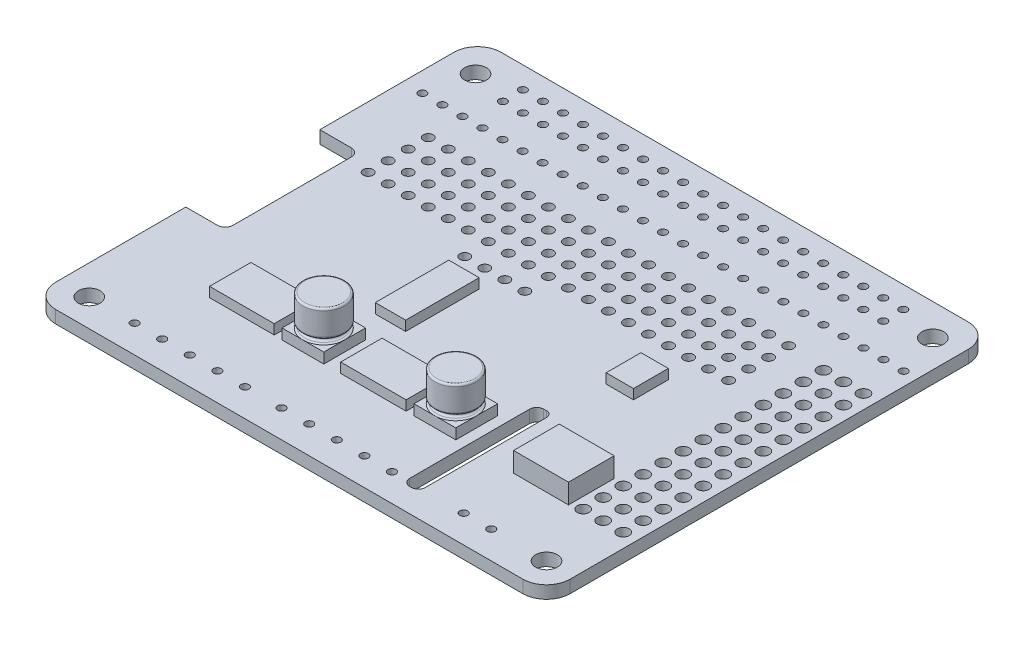
from build123d import *

# Parameters (mm, degrees)
SKETCH1_R               = 1.375
BOARD_DEPTH             = 1.6
SKETCH2_R               = 0.75
SKETCH2_R_2             = 0.5
SOME_HOLES_DEPTH        = 1.6
SKETCH2_4_R             = 0.5
SKETCH2_4_R_2           = 0.625
REMAINING_HOLES_DEPTH   = 1.6
SKETCH3_W               = 8.299273158
SKETCH3_H               = 5.249605127
SKETCH3_W_2             = 8.201345316
SKETCH3_W_3             = 3.465572732
SKETCH3_H_2             = 4.413450555
SKETCH3_W_4             = 3.853745634
SKETCH3_H_3             = 9.324821344
ICS_DEPTH               = 1.25
SKETCH3_5_W             = 6.963828066
SKETCH3_5_H             = 5.799690141
VOLTAGE_REGULATOR_DEPTH = 2.5
SKETCH4_W               = 5.3
SKETCH4_H               = 5.3
CAP_BASE_DEPTH          = 1.32
SKETCH5_R               = 2.65
CAP1_DEPTH              = 0.1
SKETCH8_R               = 2.15
CAP2_DEPTH              = 0.5
SKETCH9_R               = 2.65
SKETCH9_R_2             = 2.15
CAP3_DEPTH              = 3.38
CAP4_R                  = 0.24
CAP5_R                  = 0.25
CAP6_R                  = 0.25
CAP7_SIZE               = 0.1
CAP7_SIZE_2             = 0.25


# Some blends are built 0.0001 mm under size
with BuildPart() as part:
    # Sketch1 → Board (new body)
    with BuildSketch(Plane(origin=(0, 0, 0), x_dir=(1, 0, 0), z_dir=(0, 1, 0))):
        with BuildLine():
            Line((-12.770378968, 27.403386145), (-72.020378968, 27.403386145))
            ThreePointArc((-72.020378968, 27.403386145), (-74.141699312, 26.524706489), (-75.020378968, 24.403386145))
            Line((-75.020378968, 24.403386145), (-75.020378968, 7.403386145))
            Line((-75.020378968, 7.403386145), (-71.020378968, 7.403386145))
            ThreePointArc((-71.020378968, 7.403386145), (-70.313272187, 7.110492926), (-70.020378968, 6.403386145))
            Line((-70.020378968, 6.403386145), (-70.020378968, -8.596613855))
            ThreePointArc((-70.020378968, -8.596613855), (-70.313272187, -9.303720636), (-71.020378968, -9.596613855))
            Line((-71.020378968, -9.596613855), (-75.020378968, -9.596613855))
            Line((-75.020378968, -9.596613855), (-75.020378968, -26.096613855))
            ThreePointArc((-75.020378968, -26.096613855), (-74.141699312, -28.217934199), (-72.020378968, -29.096613855))
            Line((-72.020378968, -29.096613855), (-12.770378968, -29.096613855))
            ThreePointArc((-12.770378968, -29.096613855), (-10.649058625, -28.217934199), (-9.770378968, -26.096613855))
            Line((-9.770378968, -26.096613855), (-9.770378968, 24.403386145))
            ThreePointArc((-9.770378968, 24.403386145), (-10.649058625, 26.524706489), (-12.770378968, 27.403386145))
        make_face()
        with Locations(Location((-71.270378968, -25.596613855, 0), (0, 0, 270))):
            Circle(SKETCH1_R, mode=Mode.SUBTRACT)
        with BuildLine():
            Line((-30.120378968, -9.096613855), (-29.766856236, -9.096613855))
            ThreePointArc((-29.766856236, -9.096613855), (-29.239017098, -9.315251985), (-29.020378968, -9.843091122))
            Line((-29.020378968, -9.843091122), (-29.020378968, -25.196613855))
            ThreePointArc((-29.020378968, -25.196613855), (-29.283982865, -25.833009958), (-29.920378968, -26.096613855))
            Line((-29.920378968, -26.096613855), (-30.120378968, -26.096613855))
            ThreePointArc((-30.120378968, -26.096613855), (-30.756775072, -25.833009958), (-31.020378968, -25.196613855))
            Line((-31.020378968, -25.196613855), (-31.020378968, -9.996613855))
            ThreePointArc((-31.020378968, -9.996613855), (-30.756775072, -9.360217752), (-30.120378968, -9.096613855))
        make_face(mode=Mode.SUBTRACT)
        with Locations(Location((-13.270378968, -25.596613855, 0), (0, 0, 270))):
            Circle(SKETCH1_R, mode=Mode.SUBTRACT)
        with Locations(Location((-71.270378968, 23.403386145, 0), (0, 0, 270))):
            Circle(SKETCH1_R, mode=Mode.SUBTRACT)
        with Locations(Location((-13.270378968, 23.403386145, 0), (0, 0, 270))):
            Circle(SKETCH1_R, mode=Mode.SUBTRACT)
    extrude(amount=BOARD_DEPTH)

    # Sketch2 → Some Holes (cut)
    with BuildSketch(Plane(origin=(0, 1.6, 0), x_dir=(1, 0, 0), z_dir=(0, 1, 0))):
        with Locations(Location((-11.560378968, -15.036613855, 0), (0, 0, 270))):
            Circle(SKETCH2_R)
        with Locations(Location((-16.640378968, 7.823386145, 0), (0, 0, 270))):
            Circle(SKETCH2_R)
        with Locations(Location((-16.640378968, -17.576613855, 0), (0, 0, 270))):
            Circle(SKETCH2_R)
        with Locations(Location((-14.100378968, -17.576613855, 0), (0, 0, 270))):
            Circle(SKETCH2_R)
        with Locations(Location((-11.560378968, -17.576613855, 0), (0, 0, 270))):
            Circle(SKETCH2_R)
        with Locations(Location((-14.100378968, -15.036613855, 0), (0, 0, 270))):
            Circle(SKETCH2_R)
        with Locations(Location((-16.640378968, -15.036613855, 0), (0, 0, 270))):
            Circle(SKETCH2_R)
        with Locations(Location((-16.640378968, -12.496613855, 0), (0, 0, 270))):
            Circle(SKETCH2_R)
        with Locations(Location((-14.100378968, -12.496613855, 0), (0, 0, 270))):
            Circle(SKETCH2_R)
        with Locations(Location((-11.560378968, -12.496613855, 0), (0, 0, 270))):
            Circle(SKETCH2_R)
        with Locations(Location((-11.560378968, -9.956613855, 0), (0, 0, 270))):
            Circle(SKETCH2_R)
        with Locations(Location((-14.100378968, -9.956613855, 0), (0, 0, 270))):
            Circle(SKETCH2_R)
        with Locations(Location((-16.640378968, -9.956613855, 0), (0, 0, 270))):
            Circle(SKETCH2_R)
        with Locations(Location((-16.640378968, -7.416613855, 0), (0, 0, 270))):
            Circle(SKETCH2_R)
        with Locations(Location((-14.100378968, -7.416613855, 0), (0, 0, 270))):
            Circle(SKETCH2_R)
        with Locations(Location((-11.560378968, -7.416613855, 0), (0, 0, 270))):
            Circle(SKETCH2_R)
        with Locations(Location((-11.560378968, -4.876613855, 0), (0, 0, 270))):
            Circle(SKETCH2_R)
        with Locations(Location((-14.100378968, -4.876613855, 0), (0, 0, 270))):
            Circle(SKETCH2_R)
        with Locations(Location((-16.640378968, -4.876613855, 0), (0, 0, 270))):
            Circle(SKETCH2_R)
        with Locations(Location((-16.640378968, -2.336613855, 0), (0, 0, 270))):
            Circle(SKETCH2_R)
        with Locations(Location((-14.100378968, -2.336613855, 0), (0, 0, 270))):
            Circle(SKETCH2_R)
        with Locations(Location((-11.560378968, -2.336613855, 0), (0, 0, 270))):
            Circle(SKETCH2_R)
        with Locations(Location((-11.560378968, 0.203386145, 0), (0, 0, 270))):
            Circle(SKETCH2_R)
        with Locations(Location((-14.100378968, 0.203386145, 0), (0, 0, 270))):
            Circle(SKETCH2_R)
        with Locations(Location((-16.640378968, 0.203386145, 0), (0, 0, 270))):
            Circle(SKETCH2_R)
        with Locations(Location((-16.640378968, 2.743386145, 0), (0, 0, 270))):
            Circle(SKETCH2_R)
        with Locations(Location((-14.100378968, 2.743386145, 0), (0, 0, 270))):
            Circle(SKETCH2_R)
        with Locations(Location((-11.560378968, 2.743386145, 0), (0, 0, 270))):
            Circle(SKETCH2_R)
        with Locations(Location((-11.560378968, 5.283386145, 0), (0, 0, 270))):
            Circle(SKETCH2_R)
        with Locations(Location((-14.100378968, 5.283386145, 0), (0, 0, 270))):
            Circle(SKETCH2_R)
        with Locations(Location((-16.640378968, 5.283386145, 0), (0, 0, 270))):
            Circle(SKETCH2_R)
        with Locations(Location((-14.100378968, 7.823386145, 0), (0, 0, 270))):
            Circle(SKETCH2_R)
        with Locations(Location((-11.560378968, 7.823386145, 0), (0, 0, 270))):
            Circle(SKETCH2_R)
        with Locations(Location((-11.560378968, 10.363386145, 0), (0, 0, 270))):
            Circle(SKETCH2_R)
        with Locations(Location((-11.560378968, 12.903386145, 0), (0, 0, 270))):
            Circle(SKETCH2_R)
        with Locations(Location((-14.100378968, 10.363386145, 0), (0, 0, 270))):
            Circle(SKETCH2_R)
        with Locations(Location((-16.640378968, 10.363386145, 0), (0, 0, 270))):
            Circle(SKETCH2_R)
        with Locations(Location((-16.640378968, 12.903386145, 0), (0, 0, 270))):
            Circle(SKETCH2_R)
        with Locations(Location((-14.100378968, 12.903386145, 0), (0, 0, 270))):
            Circle(SKETCH2_R)
        with Locations(Location((-11.470378968, 17.903386145, 0), (0, 0, 270))):
            Circle(SKETCH2_R_2)
        with Locations(Location((-14.014128968, 17.903386145, 0), (0, 0, 270))):
            Circle(SKETCH2_R_2)
        with Locations(Location((-16.557878968, 17.903386145, 0), (0, 0, 270))):
            Circle(SKETCH2_R_2)
        with Locations(Location((-19.101628968, 17.903386145, 0), (0, 0, 270))):
            Circle(SKETCH2_R_2)
        with Locations(Location((-21.645378968, 17.903386145, 0), (0, 0, 270))):
            Circle(SKETCH2_R_2)
        with Locations(Location((-18.260378968, 22.113386145, 0), (0, 0, 270))):
            Circle(SKETCH2_R_2)
        with Locations(Location((-18.260378968, 24.653386145, 0), (0, 0, 270))):
            Circle(SKETCH2_R_2)
        with Locations(Location((-20.800378968, 22.113386145, 0), (0, 0, 270))):
            Circle(SKETCH2_R_2)
        with Locations(Location((-20.800378968, 24.653386145, 0), (0, 0, 270))):
            Circle(SKETCH2_R_2)
        with Locations(Location((-23.340378968, 22.113386145, 0), (0, 0, 270))):
            Circle(SKETCH2_R_2)
        with Locations(Location((-23.340378968, 24.653386145, 0), (0, 0, 270))):
            Circle(SKETCH2_R_2)
        with Locations(Location((-24.189128968, 17.903386145, 0), (0, 0, 270))):
            Circle(SKETCH2_R_2)
        with Locations(Location((-26.732878968, 17.903386145, 0), (0, 0, 270))):
            Circle(SKETCH2_R_2)
        with Locations(Location((-25.880378968, 22.113386145, 0), (0, 0, 270))):
            Circle(SKETCH2_R_2)
        with Locations(Location((-25.880378968, 24.653386145, 0), (0, 0, 270))):
            Circle(SKETCH2_R_2)
        with Locations(Location((-28.420378968, 24.653386145, 0), (0, 0, 270))):
            Circle(SKETCH2_R_2)
        with Locations(Location((-28.420378968, 22.113386145, 0), (0, 0, 270))):
            Circle(SKETCH2_R_2)
        with Locations(Location((-29.276628968, 17.903386145, 0), (0, 0, 270))):
            Circle(SKETCH2_R_2)
        with Locations(Location((-31.820378968, 17.903386145, 0), (0, 0, 270))):
            Circle(SKETCH2_R_2)
        with Locations(Location((-30.960378968, 22.113386145, 0), (0, 0, 270))):
            Circle(SKETCH2_R_2)
        with Locations(Location((-30.960378968, 24.653386145, 0), (0, 0, 270))):
            Circle(SKETCH2_R_2)
        with Locations(Location((-34.364128968, 17.903386145, 0), (0, 0, 270))):
            Circle(SKETCH2_R_2)
        with Locations(Location((-33.500378968, 22.113386145, 0), (0, 0, 270))):
            Circle(SKETCH2_R_2)
        with Locations(Location((-33.500378968, 24.653386145, 0), (0, 0, 270))):
            Circle(SKETCH2_R_2)
        with Locations(Location((-36.907878968, 17.903386145, 0), (0, 0, 270))):
            Circle(SKETCH2_R_2)
        with Locations(Location((-36.040378968, 22.113386145, 0), (0, 0, 270))):
            Circle(SKETCH2_R_2)
        with Locations(Location((-36.040378968, 24.653386145, 0), (0, 0, 270))):
            Circle(SKETCH2_R_2)
        with Locations(Location((-39.451628968, 17.903386145, 0), (0, 0, 270))):
            Circle(SKETCH2_R_2)
        with Locations(Location((-38.580378968, 22.113386145, 0), (0, 0, 270))):
            Circle(SKETCH2_R_2)
        with Locations(Location((-38.580378968, 24.653386145, 0), (0, 0, 270))):
            Circle(SKETCH2_R_2)
        with Locations(Location((-41.995378968, 17.903386145, 0), (0, 0, 270))):
            Circle(SKETCH2_R_2)
        with Locations(Location((-41.120378968, 22.113386145, 0), (0, 0, 270))):
            Circle(SKETCH2_R_2)
        with Locations(Location((-41.120378968, 24.653386145, 0), (0, 0, 270))):
            Circle(SKETCH2_R_2)
        with Locations(Location((-44.539128968, 17.903386145, 0), (0, 0, 270))):
            Circle(SKETCH2_R_2)
        with Locations(Location((-43.660378968, 22.113386145, 0), (0, 0, 270))):
            Circle(SKETCH2_R_2)
        with Locations(Location((-43.660378968, 24.653386145, 0), (0, 0, 270))):
            Circle(SKETCH2_R_2)
        with Locations(Location((-46.200378968, 24.653386145, 0), (0, 0, 270))):
            Circle(SKETCH2_R_2)
        with Locations(Location((-46.200378968, 22.113386145, 0), (0, 0, 270))):
            Circle(SKETCH2_R_2)
        with Locations(Location((-47.082878968, 17.903386145, 0), (0, 0, 270))):
            Circle(SKETCH2_R_2)
        with Locations(Location((-49.626628968, 17.903386145, 0), (0, 0, 270))):
            Circle(SKETCH2_R_2)
        with Locations(Location((-48.740378968, 22.113386145, 0), (0, 0, 270))):
            Circle(SKETCH2_R_2)
        with Locations(Location((-48.740378968, 24.653386145, 0), (0, 0, 270))):
            Circle(SKETCH2_R_2)
        with Locations(Location((-51.280378968, 24.653386145, 0), (0, 0, 270))):
            Circle(SKETCH2_R_2)
        with Locations(Location((-51.280378968, 22.113386145, 0), (0, 0, 270))):
            Circle(SKETCH2_R_2)
        with Locations(Location((-52.170378968, 17.903386145, 0), (0, 0, 270))):
            Circle(SKETCH2_R_2)
        with Locations(Location((-54.714128968, 17.903386145, 0), (0, 0, 270))):
            Circle(SKETCH2_R_2)
        with Locations(Location((-53.820378968, 22.113386145, 0), (0, 0, 270))):
            Circle(SKETCH2_R_2)
        with Locations(Location((-53.820378968, 24.653386145, 0), (0, 0, 270))):
            Circle(SKETCH2_R_2)
        with Locations(Location((-56.360378968, 24.653386145, 0), (0, 0, 270))):
            Circle(SKETCH2_R_2)
        with Locations(Location((-56.360378968, 22.113386145, 0), (0, 0, 270))):
            Circle(SKETCH2_R_2)
        with Locations(Location((-57.257878968, 17.903386145, 0), (0, 0, 270))):
            Circle(SKETCH2_R_2)
        with Locations(Location((-59.801628968, 17.903386145, 0), (0, 0, 270))):
            Circle(SKETCH2_R_2)
        with Locations(Location((-58.900378968, 22.113386145, 0), (0, 0, 270))):
            Circle(SKETCH2_R_2)
        with Locations(Location((-58.900378968, 24.653386145, 0), (0, 0, 270))):
            Circle(SKETCH2_R_2)
        with Locations(Location((-61.440378968, 24.653386145, 0), (0, 0, 270))):
            Circle(SKETCH2_R_2)
        with Locations(Location((-61.440378968, 22.113386145, 0), (0, 0, 270))):
            Circle(SKETCH2_R_2)
        with Locations(Location((-62.345378968, 17.903386145, 0), (0, 0, 270))):
            Circle(SKETCH2_R_2)
        with Locations(Location((-64.889128968, 17.903386145, 0), (0, 0, 270))):
            Circle(SKETCH2_R_2)
        with Locations(Location((-63.980378968, 22.113386145, 0), (0, 0, 270))):
            Circle(SKETCH2_R_2)
        with Locations(Location((-63.980378968, 24.653386145, 0), (0, 0, 270))):
            Circle(SKETCH2_R_2)
        with Locations(Location((-66.520378968, 24.653386145, 0), (0, 0, 270))):
            Circle(SKETCH2_R_2)
    extrude(amount=-SOME_HOLES_DEPTH, mode=Mode.SUBTRACT)

    # Sketch2<4> → Remaining Holes (cut)
    with BuildSketch(Plane(origin=(0, 1.6, 0), x_dir=(1, 0, 0), z_dir=(0, 1, 0))):
        with Locations(Location((-66.520378968, 22.113386145, 0), (0, 0, 270))):
            Circle(SKETCH2_4_R)
        with Locations(Location((-72.520378968, 17.903386145, 0), (0, 0, 270))):
            Circle(SKETCH2_4_R)
        with Locations(Location((-69.976628968, 17.903386145, 0), (0, 0, 270))):
            Circle(SKETCH2_4_R)
        with Locations(Location((-67.432878968, 17.903386145, 0), (0, 0, 270))):
            Circle(SKETCH2_4_R)
        with Locations(Location((-67.270378968, 13.403386145, 0), (0, 0, 270))):
            Circle(SKETCH2_4_R_2)
        with Locations(Location((-64.730378968, 13.403386145, 0), (0, 0, 270))):
            Circle(SKETCH2_4_R_2)
        with Locations(Location((-62.190378968, 13.403386145, 0), (0, 0, 270))):
            Circle(SKETCH2_4_R_2)
        with Locations(Location((-59.650378968, 13.403386145, 0), (0, 0, 270))):
            Circle(SKETCH2_4_R_2)
        with Locations(Location((-57.110378968, 13.403386145, 0), (0, 0, 270))):
            Circle(SKETCH2_4_R_2)
        with Locations(Location((-54.570378968, 13.403386145, 0), (0, 0, 270))):
            Circle(SKETCH2_4_R_2)
        with Locations(Location((-52.030378968, 13.403386145, 0), (0, 0, 270))):
            Circle(SKETCH2_4_R_2)
        with Locations(Location((-49.490378968, 13.403386145, 0), (0, 0, 270))):
            Circle(SKETCH2_4_R_2)
        with Locations(Location((-46.950378968, 13.403386145, 0), (0, 0, 270))):
            Circle(SKETCH2_4_R_2)
        with Locations(Location((-44.410378968, 13.403386145, 0), (0, 0, 270))):
            Circle(SKETCH2_4_R_2)
        with Locations(Location((-41.870378968, 13.403386145, 0), (0, 0, 270))):
            Circle(SKETCH2_4_R_2)
        with Locations(Location((-39.330378968, 13.403386145, 0), (0, 0, 270))):
            Circle(SKETCH2_4_R_2)
        with Locations(Location((-36.790378968, 13.403386145, 0), (0, 0, 270))):
            Circle(SKETCH2_4_R_2)
        with Locations(Location((-34.250378968, 13.403386145, 0), (0, 0, 270))):
            Circle(SKETCH2_4_R_2)
        with Locations(Location((-31.710378968, 13.403386145, 0), (0, 0, 270))):
            Circle(SKETCH2_4_R_2)
        with Locations(Location((-29.170378968, 13.403386145, 0), (0, 0, 270))):
            Circle(SKETCH2_4_R_2)
        with Locations(Location((-26.630378968, 13.403386145, 0), (0, 0, 270))):
            Circle(SKETCH2_4_R_2)
        with Locations(Location((-24.090378968, 13.403386145, 0), (0, 0, 270))):
            Circle(SKETCH2_4_R_2)
        with Locations(Location((-21.550378968, 13.403386145, 0), (0, 0, 270))):
            Circle(SKETCH2_4_R_2)
        with Locations(Location((-64.730378968, 10.863386145, 0), (0, 0, 270))):
            Circle(SKETCH2_4_R_2)
        with Locations(Location((-62.190378968, 10.863386145, 0), (0, 0, 270))):
            Circle(SKETCH2_4_R_2)
        with Locations(Location((-59.650378968, 10.863386145, 0), (0, 0, 270))):
            Circle(SKETCH2_4_R_2)
        with Locations(Location((-57.110378968, 10.863386145, 0), (0, 0, 270))):
            Circle(SKETCH2_4_R_2)
        with Locations(Location((-54.570378968, 10.863386145, 0), (0, 0, 270))):
            Circle(SKETCH2_4_R_2)
        with Locations(Location((-52.030378968, 10.863386145, 0), (0, 0, 270))):
            Circle(SKETCH2_4_R_2)
        with Locations(Location((-49.490378968, 10.863386145, 0), (0, 0, 270))):
            Circle(SKETCH2_4_R_2)
        with Locations(Location((-46.950378968, 10.863386145, 0), (0, 0, 270))):
            Circle(SKETCH2_4_R_2)
        with Locations(Location((-44.410378968, 10.863386145, 0), (0, 0, 270))):
            Circle(SKETCH2_4_R_2)
        with Locations(Location((-41.870378968, 10.863386145, 0), (0, 0, 270))):
            Circle(SKETCH2_4_R_2)
        with Locations(Location((-39.330378968, 10.863386145, 0), (0, 0, 270))):
            Circle(SKETCH2_4_R_2)
        with Locations(Location((-36.790378968, 10.863386145, 0), (0, 0, 270))):
            Circle(SKETCH2_4_R_2)
        with Locations(Location((-34.250378968, 10.863386145, 0), (0, 0, 270))):
            Circle(SKETCH2_4_R_2)
        with Locations(Location((-31.710378968, 10.863386145, 0), (0, 0, 270))):
            Circle(SKETCH2_4_R_2)
        with Locations(Location((-29.170378968, 10.863386145, 0), (0, 0, 270))):
            Circle(SKETCH2_4_R_2)
        with Locations(Location((-26.630378968, 10.863386145, 0), (0, 0, 270))):
            Circle(SKETCH2_4_R_2)
        with Locations(Location((-24.090378968, 10.863386145, 0), (0, 0, 270))):
            Circle(SKETCH2_4_R_2)
        with Locations(Location((-21.550378968, 10.863386145, 0), (0, 0, 270))):
            Circle(SKETCH2_4_R_2)
        with Locations(Location((-64.730378968, 8.323386145, 0), (0, 0, 270))):
            Circle(SKETCH2_4_R_2)
        with Locations(Location((-62.190378968, 8.323386145, 0), (0, 0, 270))):
            Circle(SKETCH2_4_R_2)
        with Locations(Location((-59.650378968, 8.323386145, 0), (0, 0, 270))):
            Circle(SKETCH2_4_R_2)
        with Locations(Location((-57.110378968, 8.323386145, 0), (0, 0, 270))):
            Circle(SKETCH2_4_R_2)
        with Locations(Location((-54.570378968, 8.323386145, 0), (0, 0, 270))):
            Circle(SKETCH2_4_R_2)
        with Locations(Location((-52.030378968, 8.323386145, 0), (0, 0, 270))):
            Circle(SKETCH2_4_R_2)
        with Locations(Location((-49.490378968, 8.323386145, 0), (0, 0, 270))):
            Circle(SKETCH2_4_R_2)
        with Locations(Location((-46.950378968, 8.323386145, 0), (0, 0, 270))):
            Circle(SKETCH2_4_R_2)
        with Locations(Location((-44.410378968, 8.323386145, 0), (0, 0, 270))):
            Circle(SKETCH2_4_R_2)
        with Locations(Location((-41.870378968, 8.323386145, 0), (0, 0, 270))):
            Circle(SKETCH2_4_R_2)
        with Locations(Location((-39.330378968, 8.323386145, 0), (0, 0, 270))):
            Circle(SKETCH2_4_R_2)
        with Locations(Location((-36.790378968, 8.323386145, 0), (0, 0, 270))):
            Circle(SKETCH2_4_R_2)
        with Locations(Location((-34.250378968, 8.323386145, 0), (0, 0, 270))):
            Circle(SKETCH2_4_R_2)
        with Locations(Location((-31.710378968, 8.323386145, 0), (0, 0, 270))):
            Circle(SKETCH2_4_R_2)
        with Locations(Location((-29.170378968, 8.323386145, 0), (0, 0, 270))):
            Circle(SKETCH2_4_R_2)
        with Locations(Location((-26.630378968, 8.323386145, 0), (0, 0, 270))):
            Circle(SKETCH2_4_R_2)
        with Locations(Location((-24.090378968, 8.323386145, 0), (0, 0, 270))):
            Circle(SKETCH2_4_R_2)
        with Locations(Location((-21.550378968, 8.323386145, 0), (0, 0, 270))):
            Circle(SKETCH2_4_R_2)
        with Locations(Location((-64.730378968, 5.783386145, 0), (0, 0, 270))):
            Circle(SKETCH2_4_R_2)
        with Locations(Location((-62.190378968, 5.783386145, 0), (0, 0, 270))):
            Circle(SKETCH2_4_R_2)
        with Locations(Location((-59.650378968, 5.783386145, 0), (0, 0, 270))):
            Circle(SKETCH2_4_R_2)
        with Locations(Location((-57.110378968, 5.783386145, 0), (0, 0, 270))):
            Circle(SKETCH2_4_R_2)
        with Locations(Location((-54.570378968, 5.783386145, 0), (0, 0, 270))):
            Circle(SKETCH2_4_R_2)
        with Locations(Location((-52.030378968, 5.783386145, 0), (0, 0, 270))):
            Circle(SKETCH2_4_R_2)
        with Locations(Location((-49.490378968, 5.783386145, 0), (0, 0, 270))):
            Circle(SKETCH2_4_R_2)
        with Locations(Location((-46.950378968, 5.783386145, 0), (0, 0, 270))):
            Circle(SKETCH2_4_R_2)
        with Locations(Location((-44.410378968, 5.783386145, 0), (0, 0, 270))):
            Circle(SKETCH2_4_R_2)
        with Locations(Location((-41.870378968, 5.783386145, 0), (0, 0, 270))):
            Circle(SKETCH2_4_R_2)
        with Locations(Location((-39.330378968, 5.783386145, 0), (0, 0, 270))):
            Circle(SKETCH2_4_R_2)
        with Locations(Location((-36.790378968, 5.783386145, 0), (0, 0, 270))):
            Circle(SKETCH2_4_R_2)
        with Locations(Location((-34.250378968, 5.783386145, 0), (0, 0, 270))):
            Circle(SKETCH2_4_R_2)
        with Locations(Location((-31.710378968, 5.783386145, 0), (0, 0, 270))):
            Circle(SKETCH2_4_R_2)
        with Locations(Location((-29.170378968, 5.783386145, 0), (0, 0, 270))):
            Circle(SKETCH2_4_R_2)
        with Locations(Location((-26.630378968, 5.783386145, 0), (0, 0, 270))):
            Circle(SKETCH2_4_R_2)
        with Locations(Location((-24.090378968, 5.783386145, 0), (0, 0, 270))):
            Circle(SKETCH2_4_R_2)
        with Locations(Location((-21.550378968, 5.783386145, 0), (0, 0, 270))):
            Circle(SKETCH2_4_R_2)
        with Locations(Location((-67.270378968, 10.863386145, 0), (0, 0, 270))):
            Circle(SKETCH2_4_R_2)
        with Locations(Location((-67.270378968, 8.323386145, 0), (0, 0, 270))):
            Circle(SKETCH2_4_R_2)
        with Locations(Location((-67.270378968, 5.783386145, 0), (0, 0, 270))):
            Circle(SKETCH2_4_R_2)
        with Locations(Location((-44.270378968, 2.653386145, 0), (0, 0, 270))):
            Circle(SKETCH2_4_R_2)
        with Locations(Location((-46.810378968, 2.653386145, 0), (0, 0, 270))):
            Circle(SKETCH2_4_R_2)
        with Locations(Location((-49.350378968, 2.653386145, 0), (0, 0, 270))):
            Circle(SKETCH2_4_R_2)
        with Locations(Location((-51.890378968, 2.653386145, 0), (0, 0, 270))):
            Circle(SKETCH2_4_R_2)
        with Locations(Location((-20.270378968, -25.596613855, 0), (0, 0, 270))):
            Circle(SKETCH2_4_R)
        with Locations(Location((-23.770378968, -25.596613855, 0), (0, 0, 270))):
            Circle(SKETCH2_4_R)
        with Locations(Location((-32.870378968, -25.596613855, 0), (0, 0, 270))):
            Circle(SKETCH2_4_R)
        with Locations(Location((-36.370378968, -25.596613855, 0), (0, 0, 270))):
            Circle(SKETCH2_4_R)
        with Locations(Location((-39.870378968, -25.596613855, 0), (0, 0, 270))):
            Circle(SKETCH2_4_R)
        with Locations(Location((-43.370378968, -25.596613855, 0), (0, 0, 270))):
            Circle(SKETCH2_4_R)
        with Locations(Location((-46.870378968, -25.596613855, 0), (0, 0, 270))):
            Circle(SKETCH2_4_R)
        with Locations(Location((-65.520378968, -25.596613855, 0), (0, 0, 270))):
            Circle(SKETCH2_4_R)
        with Locations(Location((-62.020378968, -25.596613855, 0), (0, 0, 270))):
            Circle(SKETCH2_4_R)
        with Locations(Location((-58.520378968, -25.596613855, 0), (0, 0, 270))):
            Circle(SKETCH2_4_R)
        with Locations(Location((-55.020378968, -25.596613855, 0), (0, 0, 270))):
            Circle(SKETCH2_4_R)
        with Locations(Location((-51.520378968, -25.596613855, 0), (0, 0, 270))):
            Circle(SKETCH2_4_R)
    extrude(amount=-REMAINING_HOLES_DEPTH, mode=Mode.SUBTRACT)

    # Sketch3 → ICs (add)
    with BuildSketch(Plane(origin=(0, 1.6, 0), x_dir=(1, 0, 0), z_dir=(0, 1, 0))):
        with Locations((-42.773872867, -15.424180304)):
            Rectangle(SKETCH3_W, SKETCH3_H)
        with Locations((-59.455950908, -15.424180304)):
            Rectangle(SKETCH3_W_2, SKETCH3_H)
        with Locations((-27.176884672, -0.18103568)):
            Rectangle(SKETCH3_W_3, SKETCH3_H_2)
        with Locations((-49.336031492, -4.662410672)):
            Rectangle(SKETCH3_W_4, SKETCH3_H_3)
    extrude(amount=ICS_DEPTH)

    # Sketch3<5> → Voltage Regulator (add)
    with BuildSketch(Plane(origin=(0, 1.6, 0), x_dir=(1, 0, 0), z_dir=(0, 1, 0))):
        with Locations((-21.512408584, -15.149137796)):
            Rectangle(SKETCH3_5_W, SKETCH3_5_H)
    extrude(amount=VOLTAGE_REGULATOR_DEPTH)

    # Sketch4 → Cap Base (add)
    with BuildSketch(Plane(origin=(0, 1.6, 0), x_dir=(1, 0, 0), z_dir=(0, 1, 0))):
        with Locations((-51.670378968, -15.446613855)):
            Rectangle(SKETCH4_W, SKETCH4_H)
        with Locations((-34.970378968, -15.404370659)):
            Rectangle(SKETCH4_W, SKETCH4_H)
    extrude(amount=CAP_BASE_DEPTH)

    # Sketch5 → Cap1 (add)
    with BuildSketch(Plane(origin=(0, 2.92, 0), x_dir=(1, 0, 0), z_dir=(0, 1, 0))):
        with Locations(Location((-51.670378968, -15.446613855, 0), (0, 0, 270))):
            Circle(SKETCH5_R)
        with Locations(Location((-34.970378968, -15.404370659, 0), (0, 0, 270))):
            Circle(SKETCH5_R)
    extrude(amount=CAP1_DEPTH)

    # Sketch8 → Cap2 (add)
    with BuildSketch(Plane(origin=(0, 3.02, 0), x_dir=(1, 0, 0), z_dir=(0, 1, 0))):
        with Locations(Location((-34.970378968, -15.404370659, 0), (0, 0, 270))):
            Circle(SKETCH8_R)
        with Locations(Location((-51.670378968, -15.446613855, 0), (0, 0, 270))):
            Circle(SKETCH8_R)
    extrude(amount=CAP2_DEPTH)

    # Sketch9 → Cap3 (add)
    # profile 1 of 4: a face of its own
    with BuildSketch(Plane(origin=(0, 3.52, 0), x_dir=(1, 0, 0), z_dir=(0, 1, 0))):
        with Locations(Location((-51.670378968, -15.446613855, 0), (0, 0, 270))):
            Circle(SKETCH9_R)
        with Locations(Location((-51.670378968, -15.446613855, 0), (0, 0, 270))):
            Circle(SKETCH9_R_2, mode=Mode.SUBTRACT)
    # profile 2 of 4: a face of its own
    with BuildSketch(Plane(origin=(0, 3.52, 0), x_dir=(1, 0, 0), z_dir=(0, 1, 0))):
        with Locations(Location((-51.670378968, -15.446613855, 0), (0, 0, 270))):
            Circle(SKETCH9_R_2)
    # profile 3 of 4: a face of its own
    with BuildSketch(Plane(origin=(0, 3.52, 0), x_dir=(1, 0, 0), z_dir=(0, 1, 0))):
        with Locations(Location((-34.970378968, -15.404370659, 0), (0, 0, 270))):
            Circle(SKETCH9_R)
        with Locations(Location((-34.970378968, -15.404370659, 0), (0, 0, 270))):
            Circle(SKETCH9_R_2, mode=Mode.SUBTRACT)
    # profile 4 of 4: a face of its own
    with BuildSketch(Plane(origin=(0, 3.52, 0), x_dir=(1, 0, 0), z_dir=(0, 1, 0))):
        with Locations(Location((-34.970378968, -15.404370659, 0), (0, 0, 270))):
            Circle(SKETCH9_R_2)
    extrude(amount=CAP3_DEPTH)

    # Cap4
    cap4_edges = [part.edges().sort_by_distance(p)[0] for p in [
        (-51.670378968, 6.9, 12.796613855),
        (-34.970378968, 6.9, 12.754370659),
    ]]
    fillet(cap4_edges, radius=CAP4_R)

    # Cap5
    cap5_edges = [part.edges().sort_by_distance(p)[0] for p in [
        (-34.970378968, 3.02, 13.254370659),
        (-34.970378968, 3.52, 13.254370659),
        (-51.670378968, 3.02, 13.296613855),
        (-51.670378968, 3.52, 13.296613855),
    ]]
    fillet(cap5_edges, radius=CAP5_R - 0.0001)  # a hair under: the kernel refuses the full size

    # Cap6
    cap6_edges = [part.edges().sort_by_distance(p)[0] for p in [
        (-51.670378968, 3.52, 12.796613855),
        (-34.970378968, 3.52, 12.754370659),
    ]]
    fillet(cap6_edges, radius=CAP6_R)

    # Cap7
    # an asymmetric fillet: 0.25, 0.1 mm, written as the material it takes off along each edge
    with BuildSketch(Plane(origin=(-51.670378968, 3.02, 15.446613855), x_dir=(0, 0, 1), z_dir=(-1, 0, 0))) as cap7_piece_1:
        with BuildLine():
            Bezier((2.65, -CAP7_SIZE), (2.65, 0), (2.65 - CAP7_SIZE_2, 0), weights=[1, 0.707106781, 1])
            Line((2.65 - CAP7_SIZE_2, 0), (2.65, 0))
            Line((2.65, 0), (2.65, -CAP7_SIZE))
        make_face()
    revolve(axis=Axis((-51.670378968, 3.02, 15.446613855), (0, 1, 0)), mode=Mode.SUBTRACT)
    with BuildSketch(Plane(origin=(-34.970378968, 3.02, 15.404370659), x_dir=(0, 0, 1), z_dir=(-1, 0, 0))) as cap7_piece_2:
        with BuildLine():
            Bezier((2.65 - CAP7_SIZE_2, 0), (2.65, 0), (2.65, -CAP7_SIZE), weights=[1, 0.707106781, 1])
            Line((2.65, -CAP7_SIZE), (2.65, 0))
            Line((2.65, 0), (2.65 - CAP7_SIZE_2, 0))
        make_face()
    revolve(axis=Axis((-34.970378968, 3.02, 15.404370659), (0, 1, 0)), mode=Mode.SUBTRACT)


solid = part.part
